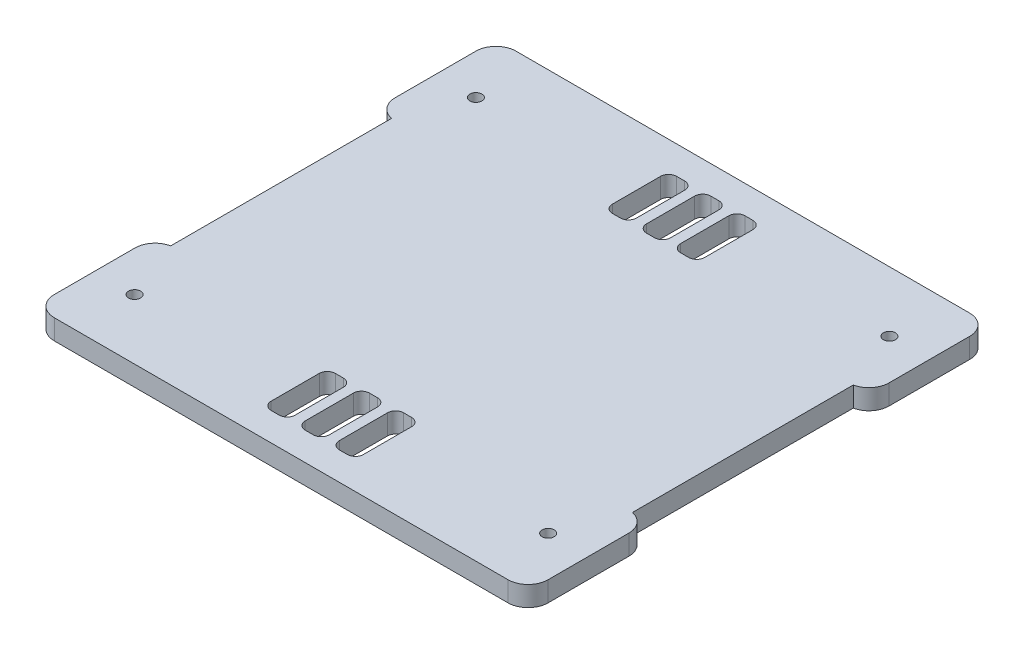
from build123d import *

# Parameters (mm, degrees)
RESSALTO_EXTRUS_O1_DEPTH = 5
FILETE1_R                = 5
ESBO_O3_R                = 1.5
CORTE_EXTRUS_O1_DEPTH    = 5


with BuildPart() as part:
    # Esboço1 → Ressalto-extrusão1 (new body)
    with BuildSketch(Plane(origin=(0, 0, 0), x_dir=(1, 0, 0), z_dir=(0, 1, 0))):
        with BuildLine():
            Line((81.90590785, -20.429188404), (85.90590785, -20.429188404))
            Line((85.90590785, -20.429188404), (85.90590785, 4.570811596))
            ThreePointArc((85.90590785, 4.570811596), (84.441441756, 8.106345502), (80.90590785, 9.570811596))
            Line((80.90590785, 9.570811596), (-32.09409215, 9.570811596))
            ThreePointArc((-32.09409215, 9.570811596), (-35.629626056, 8.106345502), (-37.09409215, 4.570811596))
            Line((-37.09409215, 4.570811596), (-37.09409215, -20.429188404))
            Line((-37.09409215, -20.429188404), (-33.09409215, -20.429188404))
            Line((-33.09409215, -20.429188404), (-33.09409215, -75.429188404))
            Line((-33.09409215, -75.429188404), (-37.09409215, -75.429188404))
            Line((-37.09409215, -75.429188404), (-37.09409215, -100.429188404))
            ThreePointArc((-37.09409215, -100.429188404), (-35.629626056, -103.96472231), (-32.09409215, -105.429188404))
            Line((-32.09409215, -105.429188404), (80.90590785, -105.429188404))
            ThreePointArc((80.90590785, -105.429188404), (84.441441756, -103.96472231), (85.90590785, -100.429188404))
            Line((85.90590785, -100.429188404), (85.90590785, -75.429188404))
            Line((85.90590785, -75.429188404), (81.90590785, -75.429188404))
            Line((81.90590785, -75.429188404), (81.90590785, -20.429188404))
        make_face()
    extrude(amount=RESSALTO_EXTRUS_O1_DEPTH)

    # Filete1
    # the kernel refuses this fillet: 5 mm, written as the material it takes off along each edge
    with BuildSketch(Plane(origin=(-37.09409215, -12.247448714, 75.429188404), x_dir=(1.0, 0, 1.5738521597081158e-12), z_dir=(0, 1, 0)), Plane(origin=(85.90590785, -12.247448714, 20.429188404), x_dir=(-1.0, 0, -1.5685230891899197e-12), z_dir=(0, 1, 0))) as filete1_piece_1:
        with BuildLine():
            CenterArc((5, -4.898979486), FILETE1_R, 101.536959033, 78.463040967)
            Line((0, -4.898979486), (-0.1, -4.898979486))
            Line((-0.1, -4.898979486), (-0.1, 0))
            Line((-0.1, 0), (0, 0.1))
            ThreePointArc((0, 0.1), (2, 0.1), (3.98, 0.09797959))
            Line((3.98, 0.09797959), (4, 0))
        make_face()
    extrude(amount=29.494897428, mode=Mode.SUBTRACT)
    with BuildSketch(Plane(origin=(-37.09409215, -12.247448714, 20.429188404), x_dir=(0, 0, -1), z_dir=(0, 1, 0)), Plane(origin=(85.90590785, -12.247448714, 75.429188404), x_dir=(0, 0, 1), z_dir=(0, 1, 0))) as filete1_piece_2:
        with BuildLine():
            CenterArc((4.898979486, -5), FILETE1_R, 90, 78.463040967)
            Line((0, -4), (-0.09797959, -3.98))
            ThreePointArc((-0.09797959, -3.98), (-0.1, -2), (-0.1, 0))
            Line((-0.1, 0), (0, 0.1))
            Line((0, 0.1), (4.898979486, 0.1))
            Line((4.898979486, 0.1), (4.898979486, 0))
        make_face()
    extrude(amount=29.494897428, mode=Mode.SUBTRACT)

    # Esboço3 → Corte-extrusão1 (cut)
    with BuildSketch(Plane.XZ):
        with Locations(Location((-27.09409215, 5.429188404, 0), (0, 0, 270))):
            Circle(ESBO_O3_R)
        with Locations(Location((75.90590785, 5.429188404, 0), (0, 0, 270))):
            Circle(ESBO_O3_R)
        with Locations(Location((75.90590785, 90.429188404, 0), (0, 0, 90))):
            Circle(ESBO_O3_R)
        with Locations(Location((-27.09409215, 90.429188404, 0), (0, 0, 90))):
            Circle(ESBO_O3_R)
        with BuildLine():
            Line((35.90590785, 84.429188404), (35.90590785, 96.429188404))
            ThreePointArc((35.90590785, 96.429188404), (35.320121412, 97.843401966), (33.90590785, 98.429188404))
            Line((33.90590785, 98.429188404), (31.90590785, 98.429188404))
            ThreePointArc((31.90590785, 98.429188404), (30.491694287, 97.843401966), (29.90590785, 96.429188404))
            Line((29.90590785, 96.429188404), (29.90590785, 84.429188404))
            ThreePointArc((29.90590785, 84.429188404), (30.491694287, 83.014974841), (31.90590785, 82.429188404))
            Line((31.90590785, 82.429188404), (33.90590785, 82.429188404))
            ThreePointArc((33.90590785, 82.429188404), (35.320121412, 83.014974841), (35.90590785, 84.429188404))
        make_face()
        with BuildLine():
            Line((14.90590785, 13.429188404), (16.90590785, 13.429188404))
            ThreePointArc((16.90590785, 13.429188404), (18.320121412, 12.843401966), (18.90590785, 11.429188404))
            Line((18.90590785, 11.429188404), (18.90590785, -0.570811596))
            ThreePointArc((18.90590785, -0.570811596), (18.320121412, -1.985025159), (16.90590785, -2.570811596))
            Line((16.90590785, -2.570811596), (14.90590785, -2.570811596))
            ThreePointArc((14.90590785, -2.570811596), (13.491694287, -1.985025159), (12.90590785, -0.570811596))
            Line((12.90590785, -0.570811596), (12.90590785, 11.429188404))
            ThreePointArc((12.90590785, 11.429188404), (13.491694287, 12.843401966), (14.90590785, 13.429188404))
        make_face()
        with BuildLine():
            Line((23.40590785, 13.429188404), (25.40590785, 13.429188404))
            ThreePointArc((25.40590785, 13.429188404), (26.820121412, 12.843401966), (27.40590785, 11.429188404))
            Line((27.40590785, 11.429188404), (27.40590785, -0.570811596))
            ThreePointArc((27.40590785, -0.570811596), (26.820121412, -1.985025159), (25.40590785, -2.570811596))
            Line((25.40590785, -2.570811596), (23.40590785, -2.570811596))
            ThreePointArc((23.40590785, -2.570811596), (21.991694287, -1.985025159), (21.40590785, -0.570811596))
            Line((21.40590785, -0.570811596), (21.40590785, 11.429188404))
            ThreePointArc((21.40590785, 11.429188404), (21.991694287, 12.843401966), (23.40590785, 13.429188404))
        make_face()
        with BuildLine():
            Line((31.90590785, 13.429188404), (33.90590785, 13.429188404))
            ThreePointArc((33.90590785, 13.429188404), (35.320121412, 12.843401966), (35.90590785, 11.429188404))
            Line((35.90590785, 11.429188404), (35.90590785, -0.570811596))
            ThreePointArc((35.90590785, -0.570811596), (35.320121412, -1.985025159), (33.90590785, -2.570811596))
            Line((33.90590785, -2.570811596), (31.90590785, -2.570811596))
            ThreePointArc((31.90590785, -2.570811596), (30.491694287, -1.985025159), (29.90590785, -0.570811596))
            Line((29.90590785, -0.570811596), (29.90590785, 11.429188404))
            ThreePointArc((29.90590785, 11.429188404), (30.491694287, 12.843401966), (31.90590785, 13.429188404))
        make_face()
        with BuildLine():
            Line((27.40590785, 84.429188404), (27.40590785, 96.429188404))
            ThreePointArc((27.40590785, 96.429188404), (26.820121412, 97.843401966), (25.40590785, 98.429188404))
            Line((25.40590785, 98.429188404), (23.40590785, 98.429188404))
            ThreePointArc((23.40590785, 98.429188404), (21.991694287, 97.843401966), (21.40590785, 96.429188404))
            Line((21.40590785, 96.429188404), (21.40590785, 84.429188404))
            ThreePointArc((21.40590785, 84.429188404), (21.991694287, 83.014974841), (23.40590785, 82.429188404))
            Line((23.40590785, 82.429188404), (25.40590785, 82.429188404))
            ThreePointArc((25.40590785, 82.429188404), (26.820121412, 83.014974841), (27.40590785, 84.429188404))
        make_face()
        with BuildLine():
            Line((18.90590785, 84.429188404), (18.90590785, 96.429188404))
            ThreePointArc((18.90590785, 96.429188404), (18.320121412, 97.843401966), (16.90590785, 98.429188404))
            Line((16.90590785, 98.429188404), (14.90590785, 98.429188404))
            ThreePointArc((14.90590785, 98.429188404), (13.491694287, 97.843401966), (12.90590785, 96.429188404))
            Line((12.90590785, 96.429188404), (12.90590785, 84.429188404))
            ThreePointArc((12.90590785, 84.429188404), (13.491694287, 83.014974841), (14.90590785, 82.429188404))
            Line((14.90590785, 82.429188404), (16.90590785, 82.429188404))
            ThreePointArc((16.90590785, 82.429188404), (18.320121412, 83.014974841), (18.90590785, 84.429188404))
        make_face()
    extrude(amount=-CORTE_EXTRUS_O1_DEPTH, mode=Mode.SUBTRACT)


solid = part.part
